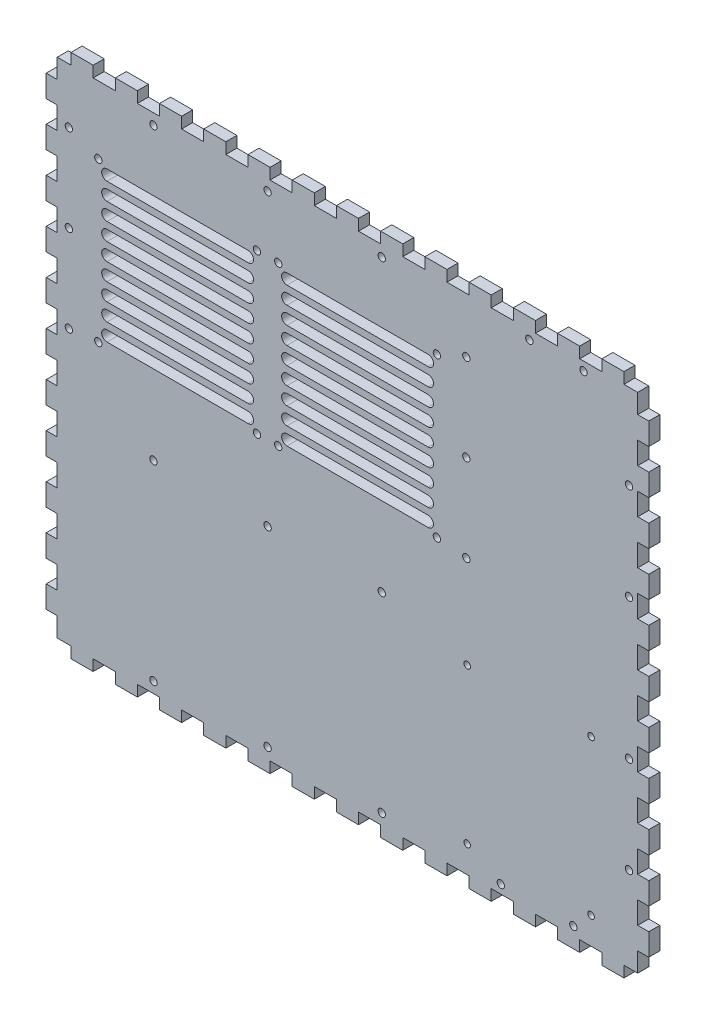
from build123d import *

# Parameters (mm, degrees)
BOSS_EXTRUDE1_DEPTH   = 5.715
F_6_CLEARANCE_HOLE1_D = 3.7973
CUT_EXTRUDE1_DEPTH    = 10
F_6_CLEARANCE_HOLE2_D = 3.7973
M3_CLEARANCE_HOLE1_D  = 3.4


with BuildPart() as part:
    # Model → Boss-Extrude1 (new body)
    with BuildSketch(Plane.XY):
        Polygon((644.691, 28.5722), (651.813, 28.5722), (651.813, 22.8575), (663.247, 22.8575), (663.247, 28.5722), (674.673, 28.5722), (674.673, 22.8575), (686.103, 22.8575), (686.103, 28.5722), (697.537, 28.5722), (697.537, 22.8575), (708.963, 22.8575), (708.963, 28.5722), (720.397, 28.5722), (720.397, 22.8575), (731.823, 22.8575), (731.823, 28.5722), (743.253, 28.5722), (743.253, 22.8575), (754.687, 22.8575), (754.687, 28.5722), (766.113, 28.5722), (766.113, 22.8575), (777.547, 22.8575), (777.547, 28.5722), (788.973, 28.5722), (788.973, 22.8575), (800.403, 22.8575), (800.403, 28.5722), (811.837, 28.5722), (811.837, 22.8575), (823.263, 22.8575), (823.263, 28.5722), (834.697, 28.5722), (834.697, 22.8575), (846.123, 22.8575), (846.123, 28.5722), (857.553, 28.5722), (857.553, 22.8575), (868.987, 22.8575), (868.987, 28.5722), (880.413, 28.5722), (880.413, 22.8575), (891.847, 22.8575), (891.847, 28.5722), (903.273, 28.5722), (903.273, 22.8575), (914.703, 22.8575), (914.703, 28.5722), (926.137, 28.5722), (926.137, 22.8575), (937.563, 22.8575), (937.563, 28.5722), (944.69, 28.5722), (944.69, 38.5576), (950.405, 38.5576), (950.405, 49.9868), (944.69, 49.9868), (944.69, 61.4179), (950.405, 61.4179), (950.405, 72.8472), (944.69, 72.8472), (944.69, 84.2779), (950.405, 84.2779), (950.405, 95.7076), (944.69, 95.7076), (944.69, 107.137), (950.405, 107.137), (950.405, 118.568), (944.69, 118.568), (944.69, 129.997), (950.405, 129.997), (950.405, 141.428), (944.69, 141.428), (944.69, 152.858), (950.405, 152.858), (950.405, 164.287), (944.69, 164.287), (944.69, 175.718), (950.405, 175.718), (950.405, 187.147), (944.69, 187.147), (944.69, 198.578), (950.405, 198.578), (950.405, 210.008), (944.69, 210.008), (944.69, 221.437), (950.405, 221.437), (950.405, 232.868), (944.69, 232.868), (944.69, 244.297), (950.405, 244.297), (950.405, 255.728), (944.69, 255.728), (944.69, 267.158), (950.405, 267.158), (950.405, 278.587), (944.69, 278.587), (944.69, 288.572), (937.563, 288.572), (937.563, 294.287), (926.137, 294.287), (926.137, 288.572), (914.703, 288.572), (914.703, 294.287), (903.273, 294.287), (903.273, 288.572), (891.847, 288.572), (891.847, 294.287), (880.413, 294.287), (880.413, 288.572), (868.987, 288.572), (868.987, 294.287), (857.553, 294.287), (857.553, 288.572), (846.123, 288.572), (846.123, 294.287), (834.697, 294.287), (834.697, 288.572), (823.263, 288.572), (823.263, 294.287), (811.837, 294.287), (811.837, 288.572), (800.403, 288.572), (800.403, 294.287), (788.973, 294.287), (788.973, 288.572), (777.547, 288.572), (777.547, 294.287), (766.113, 294.287), (766.113, 288.572), (754.687, 288.572), (754.687, 294.287), (743.253, 294.287), (743.253, 288.572), (731.823, 288.572), (731.823, 294.287), (720.397, 294.287), (720.397, 288.572), (708.963, 288.572), (708.963, 294.287), (697.537, 294.287), (697.537, 288.572), (686.103, 288.572), (686.103, 294.287), (674.673, 294.287), (674.673, 288.572), (663.247, 288.572), (663.247, 294.287), (651.813, 294.287), (651.813, 288.572), (644.691, 288.572), (644.691, 278.587), (638.976, 278.587), (638.976, 267.158), (644.691, 267.158), (644.691, 255.728), (638.976, 255.728), (638.976, 244.297), (644.691, 244.297), (644.691, 232.868), (638.976, 232.868), (638.976, 221.437), (644.691, 221.437), (644.691, 210.008), (638.976, 210.008), (638.976, 198.578), (644.691, 198.578), (644.691, 187.147), (638.976, 187.147), (638.976, 175.718), (644.691, 175.718), (644.691, 164.287), (638.976, 164.287), (638.976, 152.858), (644.691, 152.858), (644.691, 141.428), (638.976, 141.428), (638.976, 129.997), (644.691, 129.997), (644.691, 118.568), (638.976, 118.568), (638.976, 107.137), (644.691, 107.137), (644.691, 95.7076), (638.976, 95.7076), (638.976, 84.2779), (644.691, 84.2779), (644.691, 72.8472), (638.976, 72.8472), (638.976, 61.4179), (644.691, 61.4179), (644.691, 49.9868), (638.976, 49.9868), (638.976, 38.5576), (644.691, 38.5576), align=None)
    extrude(amount=BOSS_EXTRUDE1_DEPTH)

    # #6 Clearance Hole1 (through all)
    with Locations(Plane.XY.offset(5.715)):
        with Locations((665.90725, 253.6719), (747.90725, 253.6719), (758.90725, 253.6719), (840.90725, 253.6719), (840.90725, 171.6719), (758.90725, 171.6719), (747.90725, 171.6719), (665.90725, 171.6719)):
            Hole(F_6_CLEARANCE_HOLE1_D / 2)

    # Sketch1 → Cut-Extrude1 (cut)
    with BuildSketch(Plane(origin=(0, 0, 0), x_dir=(-1, 0, 0), z_dir=(0, 0, -1))):
        with BuildLine():
            Line((-836.40725, 251.4219), (-763.40725, 251.4219))
            ThreePointArc((-763.40725, 251.4219), (-760.65725, 248.6719), (-763.40725, 245.9219))
            Line((-763.40725, 245.9219), (-836.40725, 245.9219))
            ThreePointArc((-836.40725, 245.9219), (-839.15725, 248.6719), (-836.40725, 251.4219))
        make_face()
        with BuildLine():
            Line((-836.40725, 236.9219), (-763.40725, 236.9219))
            ThreePointArc((-763.40725, 236.9219), (-760.65725, 239.6719), (-763.40725, 242.4219))
            Line((-763.40725, 242.4219), (-836.40725, 242.4219))
            ThreePointArc((-836.40725, 242.4219), (-839.15725, 239.6719), (-836.40725, 236.9219))
        make_face()
        with BuildLine():
            Line((-836.40725, 227.9219), (-763.40725, 227.9219))
            ThreePointArc((-763.40725, 227.9219), (-760.65725, 230.6719), (-763.40725, 233.4219))
            Line((-763.40725, 233.4219), (-836.40725, 233.4219))
            ThreePointArc((-836.40725, 233.4219), (-839.15725, 230.6719), (-836.40725, 227.9219))
        make_face()
        with BuildLine():
            Line((-836.40725, 218.9219), (-763.40725, 218.9219))
            ThreePointArc((-763.40725, 218.9219), (-760.65725, 221.6719), (-763.40725, 224.4219))
            Line((-763.40725, 224.4219), (-836.40725, 224.4219))
            ThreePointArc((-836.40725, 224.4219), (-839.15725, 221.6719), (-836.40725, 218.9219))
        make_face()
        with BuildLine():
            Line((-836.40725, 209.9219), (-763.40725, 209.9219))
            ThreePointArc((-763.40725, 209.9219), (-760.65725, 212.6719), (-763.40725, 215.4219))
            Line((-763.40725, 215.4219), (-836.40725, 215.4219))
            ThreePointArc((-836.40725, 215.4219), (-839.15725, 212.6719), (-836.40725, 209.9219))
        make_face()
        with BuildLine():
            Line((-836.40725, 200.9219), (-763.40725, 200.9219))
            ThreePointArc((-763.40725, 200.9219), (-760.65725, 203.6719), (-763.40725, 206.4219))
            Line((-763.40725, 206.4219), (-836.40725, 206.4219))
            ThreePointArc((-836.40725, 206.4219), (-839.15725, 203.6719), (-836.40725, 200.9219))
        make_face()
        with BuildLine():
            Line((-836.40725, 191.9219), (-763.40725, 191.9219))
            ThreePointArc((-763.40725, 191.9219), (-760.65725, 194.6719), (-763.40725, 197.4219))
            Line((-763.40725, 197.4219), (-836.40725, 197.4219))
            ThreePointArc((-836.40725, 197.4219), (-839.15725, 194.6719), (-836.40725, 191.9219))
        make_face()
        with BuildLine():
            Line((-836.40725, 182.9219), (-763.40725, 182.9219))
            ThreePointArc((-763.40725, 182.9219), (-760.65725, 185.6719), (-763.40725, 188.4219))
            Line((-763.40725, 188.4219), (-836.40725, 188.4219))
            ThreePointArc((-836.40725, 188.4219), (-839.15725, 185.6719), (-836.40725, 182.9219))
        make_face()
        with BuildLine():
            Line((-836.40725, 173.9219), (-763.40725, 173.9219))
            ThreePointArc((-763.40725, 173.9219), (-760.65725, 176.6719), (-763.40725, 179.4219))
            Line((-763.40725, 179.4219), (-836.40725, 179.4219))
            ThreePointArc((-836.40725, 179.4219), (-839.15725, 176.6719), (-836.40725, 173.9219))
        make_face()
        with BuildLine():
            Line((-670.40725, 179.4219), (-743.40725, 179.4219))
            ThreePointArc((-743.40725, 179.4219), (-746.15725, 176.6719), (-743.40725, 173.9219))
            Line((-743.40725, 173.9219), (-670.40725, 173.9219))
            ThreePointArc((-670.40725, 173.9219), (-667.65725, 176.6719), (-670.40725, 179.4219))
        make_face()
        with BuildLine():
            Line((-670.40725, 188.4219), (-743.40725, 188.4219))
            ThreePointArc((-743.40725, 188.4219), (-746.15725, 185.6719), (-743.40725, 182.9219))
            Line((-743.40725, 182.9219), (-670.40725, 182.9219))
            ThreePointArc((-670.40725, 182.9219), (-667.65725, 185.6719), (-670.40725, 188.4219))
        make_face()
        with BuildLine():
            Line((-670.40725, 197.4219), (-743.40725, 197.4219))
            ThreePointArc((-743.40725, 197.4219), (-746.15725, 194.6719), (-743.40725, 191.9219))
            Line((-743.40725, 191.9219), (-670.40725, 191.9219))
            ThreePointArc((-670.40725, 191.9219), (-667.65725, 194.6719), (-670.40725, 197.4219))
        make_face()
        with BuildLine():
            Line((-670.40725, 206.4219), (-743.40725, 206.4219))
            ThreePointArc((-743.40725, 206.4219), (-746.15725, 203.6719), (-743.40725, 200.9219))
            Line((-743.40725, 200.9219), (-670.40725, 200.9219))
            ThreePointArc((-670.40725, 200.9219), (-667.65725, 203.6719), (-670.40725, 206.4219))
        make_face()
        with BuildLine():
            Line((-670.40725, 215.4219), (-743.40725, 215.4219))
            ThreePointArc((-743.40725, 215.4219), (-746.15725, 212.6719), (-743.40725, 209.9219))
            Line((-743.40725, 209.9219), (-670.40725, 209.9219))
            ThreePointArc((-670.40725, 209.9219), (-667.65725, 212.6719), (-670.40725, 215.4219))
        make_face()
        with BuildLine():
            Line((-670.40725, 224.4219), (-743.40725, 224.4219))
            ThreePointArc((-743.40725, 224.4219), (-746.15725, 221.6719), (-743.40725, 218.9219))
            Line((-743.40725, 218.9219), (-670.40725, 218.9219))
            ThreePointArc((-670.40725, 218.9219), (-667.65725, 221.6719), (-670.40725, 224.4219))
        make_face()
        with BuildLine():
            Line((-670.40725, 233.4219), (-743.40725, 233.4219))
            ThreePointArc((-743.40725, 233.4219), (-746.15725, 230.6719), (-743.40725, 227.9219))
            Line((-743.40725, 227.9219), (-670.40725, 227.9219))
            ThreePointArc((-670.40725, 227.9219), (-667.65725, 230.6719), (-670.40725, 233.4219))
        make_face()
        with BuildLine():
            Line((-670.40725, 242.4219), (-743.40725, 242.4219))
            ThreePointArc((-743.40725, 242.4219), (-746.15725, 239.6719), (-743.40725, 236.9219))
            Line((-743.40725, 236.9219), (-670.40725, 236.9219))
            ThreePointArc((-670.40725, 236.9219), (-667.65725, 239.6719), (-670.40725, 242.4219))
        make_face()
        with BuildLine():
            Line((-670.40725, 251.4219), (-743.40725, 251.4219))
            ThreePointArc((-743.40725, 251.4219), (-746.15725, 248.6719), (-743.40725, 245.9219))
            Line((-743.40725, 245.9219), (-670.40725, 245.9219))
            ThreePointArc((-670.40725, 245.9219), (-667.65725, 248.6719), (-670.40725, 251.4219))
        make_face()
    extrude(amount=-CUT_EXTRUDE1_DEPTH, mode=Mode.SUBTRACT)

    # #6 Clearance Hole2 (through all)
    with Locations(Plane.XY.offset(5.715)):
        with Locations((694.40725, 282.9467), (753.40725, 282.9467), (812.40725, 282.9467), (856.1235, 260.12195), (888.69, 284.072), (916.69, 284.072), (940.19, 244.6429375), (940.19, 194.7848125), (856.1235, 215.12195), (856.1235, 170.12195), (650.691, 260.12195), (650.691, 215.12195), (650.691, 170.12195), (694.40725, 132.9469), (753.40725, 132.9469), (812.40725, 132.9469), (940.19, 122.3593875), (940.19, 72.5012625), (911.44, 33.0722), (873.94, 33.0722), (812.40725, 34.1972), (753.40725, 34.1972), (694.40725, 34.1972)):
            Hole(F_6_CLEARANCE_HOLE2_D / 2)

    # M3 Clearance Hole1 (through all)
    with Locations(Plane(origin=(0, 0, 0), x_dir=(-1, 0, 0), z_dir=(0, 0, -1))):
        with Locations((-856.586, 122.4469), (-920.586, 122.4469), (-920.586, 42.4469), (-856.586, 42.4469)):
            Hole(M3_CLEARANCE_HOLE1_D / 2)


solid = part.part
